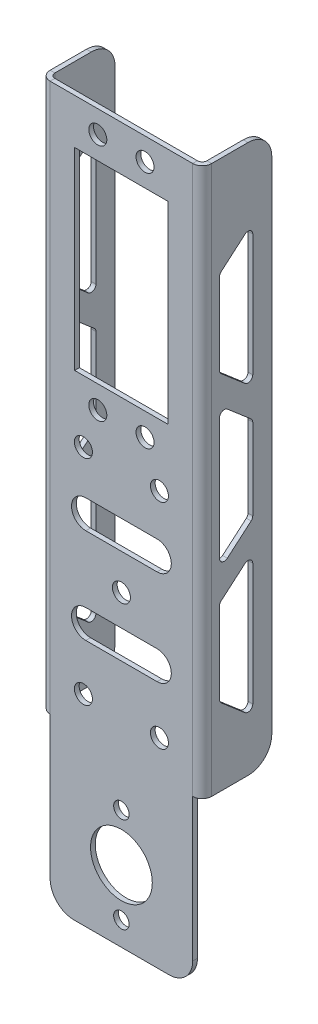
from build123d import *

# Parameters (mm, degrees)
SKETCH1_R                  = 6.5
SKETCH1_W                  = 19.7
SKETCH1_H                  = 40.64
BASE_FLANGE1_DEPTH         = 1
FILLET1_R                  = 5
F_6_CLEARANCE_HOLE1_D      = 3.7973
SKETCHED_START             = 16.78876
SKETCHED_BEND1_OUTLINE_W   = 115.36
SKETCHED_BEND1_OUTLINE_H   = 1
SKETCHED_BEND1_DEPTH       = 13.21124
SKETCHED_START_2           = -30
SKETCHED_BEND1_2_OUTLINE_W = 115.36
SKETCHED_BEND1_2_OUTLINE_H = 1
SKETCHED_BEND1_2_DEPTH     = 13.18876
SKETCHED_START_3           = -17
SKETCHED_BEND1_3_DEPTH     = 2
SKETCHED_START_4           = 15
SKETCHED_BEND1_4_DEPTH     = 2
SKETCHED_START_5           = -40.18
SKETCHED_BEND1_5_DEPTH     = 115.36
F_4_CLEARANCE_HOLE1_D      = 3.2639
FILLET2_R                  = 1
F_6_CLEARANCE_HOLE2_D      = 3.7973
CUT_EXTRUDE1_DEPTH         = 10


with BuildPart() as part:
    # Base-Flange1: sheet metal written as solids
    # Sketch1 → Base-Flange1 (new body)
    with BuildSketch(Plane.XY):
        Polygon((-30, 75.18), (30, 75.18), (30, -40.18), (15, -40.18), (15, -75.18), (-15, -75.18), (-15, -40.18), (-30, -40.18), align=None)
        with Locations((0, -60.18)):
            Circle(SKETCH1_R, mode=Mode.SUBTRACT)
        Polygon((-26, 60.18), (-19, 54.18), (-19, 36.18), (-26, 30.18), align=None, mode=Mode.SUBTRACT)
        with Locations((0, 45.36)):
            Rectangle(SKETCH1_W, SKETCH1_H, mode=Mode.SUBTRACT)
        Polygon((-26, 24.18), (-19, 30.18), (-19, 0.18), (-26, 6.18), align=None, mode=Mode.SUBTRACT)
        Polygon((-26, -29.82), (-26, 0.18), (-19, -5.82), (-19, -23.82), align=None, mode=Mode.SUBTRACT)
        Polygon((19, -23.82), (26, -29.82), (26, 0.18), (19, -5.82), align=None, mode=Mode.SUBTRACT)
        Polygon((19, 0.18), (26, 6.18), (26, 24.18), (19, 30.18), align=None, mode=Mode.SUBTRACT)
        Polygon((19, 36.18), (26, 30.18), (26, 60.18), (19, 54.18), align=None, mode=Mode.SUBTRACT)
    extrude(amount=-BASE_FLANGE1_DEPTH)

    # Fillet1
    fillet1_edges = [part.edges().sort_by_distance(p)[0] for p in [
        (-30, 75.18, -0.5),
        (30, 75.18, -0.5),
        (30, -40.18, -0.5),
        (15, -75.18, -0.5),
        (-15, -75.18, -0.5),
        (-30, -40.18, -0.5),
    ]]
    fillet(fillet1_edges, radius=FILLET1_R)

    # #6 Clearance Hole1 (through all)
    with Locations(Plane.XY):
        with Locations((-4.97, 70.46), (4.97, 70.46), (-4.97, 20.26), (4.97, 20.26)):
            Hole(F_6_CLEARANCE_HOLE1_D / 2)

    # Sketched Bend1: read off the stored shape, not the designer's step
    # Sketched Bend1 outline → Sketched Bend1 (cut)
    with BuildSketch(Plane.YZ.offset(SKETCHED_START)):
        with Locations((17.5, -0.5)):
            Rectangle(SKETCHED_BEND1_OUTLINE_W, SKETCHED_BEND1_OUTLINE_H)
    extrude(amount=SKETCHED_BEND1_DEPTH, mode=Mode.SUBTRACT)

    # Sketched Bend1 2 outline → Sketched Bend1 2 (cut)
    with BuildSketch(Plane.YZ.offset(SKETCHED_START_2)):
        with Locations((17.5, -0.5)):
            Rectangle(SKETCHED_BEND1_2_OUTLINE_W, SKETCHED_BEND1_2_OUTLINE_H)
    extrude(amount=SKETCHED_BEND1_2_DEPTH, mode=Mode.SUBTRACT)

    # Sketched Bend1 3 outline → Sketched Bend1 3 (add)
    with BuildSketch(Plane.YZ.offset(SKETCHED_START_3)):
        with BuildLine():
            Line((75.18, -9.64380551), (75.18, -1))
            Line((75.18, -1), (-40.18, -1))
            Line((-40.18, -1), (-40.18, -9.64380551))
            ThreePointArc((-40.18, -9.64380551), (-38.715533906, -13.179339416), (-35.18, -14.64380551))
            Line((-35.18, -14.64380551), (70.18, -14.64380551))
            ThreePointArc((70.18, -14.64380551), (73.715533906, -13.179339416), (75.18, -9.64380551))
        make_face()
        Polygon((-23.82, -3.64380551), (-5.82, -3.64380551), (0.18, -10.64380551), (-29.82, -10.64380551), align=None, mode=Mode.SUBTRACT)
        Polygon((0.18, -3.64380551), (30.18, -3.64380551), (24.18, -10.64380551), (6.18, -10.64380551), align=None, mode=Mode.SUBTRACT)
        Polygon((54.18, -3.64380551), (60.18, -10.64380551), (30.18, -10.64380551), (36.18, -3.64380551), align=None, mode=Mode.SUBTRACT)
    extrude(amount=SKETCHED_BEND1_3_DEPTH)

    # Sketched Bend1 4 outline → Sketched Bend1 4 (add)
    with BuildSketch(Plane.YZ.offset(SKETCHED_START_4)):
        with BuildLine():
            Line((75.18, -9.64380551), (75.18, -1))
            Line((75.18, -1), (-40.18, -1))
            Line((-40.18, -1), (-40.18, -9.64380551))
            ThreePointArc((-40.18, -9.64380551), (-38.715533906, -13.179339416), (-35.18, -14.64380551))
            Line((-35.18, -14.64380551), (70.18, -14.64380551))
            ThreePointArc((70.18, -14.64380551), (73.715533906, -13.179339416), (75.18, -9.64380551))
        make_face()
        Polygon((-23.82, -3.64380551), (-5.82, -3.64380551), (0.18, -10.64380551), (-29.82, -10.64380551), align=None, mode=Mode.SUBTRACT)
        Polygon((0.18, -3.64380551), (30.18, -3.64380551), (24.18, -10.64380551), (6.18, -10.64380551), align=None, mode=Mode.SUBTRACT)
        Polygon((54.18, -3.64380551), (60.18, -10.64380551), (30.18, -10.64380551), (36.18, -3.64380551), align=None, mode=Mode.SUBTRACT)
    extrude(amount=SKETCHED_BEND1_4_DEPTH)

    # Sketched Bend1 5 outline → Sketched Bend1 5 (cut)
    with BuildSketch(Plane(origin=(0, 0, 0), x_dir=(1, 0, 0), z_dir=(0, 1, 0)).offset(SKETCHED_START_5)):
        with BuildLine():
            ThreePointArc((-16, 2), (-15.707106781, 1.292893219), (-15, 1))
            Line((-15, 1), (-15, 14.64380551))
            Line((-15, 14.64380551), (-16, 14.64380551))
            Line((-16, 14.64380551), (-16, 2))
        make_face()
        with BuildLine():
            ThreePointArc((17, 2), (16.414213562, 0.585786438), (15, 0))
            Line((15, 0), (16.78876, 0))
            Line((16.78876, 0), (16.78876, 1))
            Line((16.78876, 1), (17, 1))
            Line((17, 1), (17, 2))
        make_face()
        with BuildLine():
            ThreePointArc((-15, 0), (-16.414213562, 0.585786438), (-17, 2))
            Line((-17, 2), (-17, 1))
            Line((-17, 1), (-16.81124, 1))
            Line((-16.81124, 1), (-16.81124, 0))
            Line((-16.81124, 0), (-15, 0))
        make_face()
        with BuildLine():
            ThreePointArc((15, 1), (15.707106781, 1.292893219), (16, 2))
            Line((16, 2), (16, 14.64380551))
            Line((16, 14.64380551), (15, 14.64380551))
            Line((15, 14.64380551), (15, 1))
        make_face()
    extrude(amount=SKETCHED_BEND1_5_DEPTH, mode=Mode.SUBTRACT)

    # #4 Clearance Hole1 (through all)
    with Locations(Plane.XY):
        with Locations((0, -50.18), (0, -70.18)):
            Hole(F_4_CLEARANCE_HOLE1_D / 2)

    # Fillet2
    fillet2_edges = [part.edges().sort_by_distance(p)[0] for p in [
        (-16.5, 54.18, -3.64380551),
        (-16.5, 36.18, -3.64380551),
        (-16.5, 30.18, -10.64380551),
        (-16.5, 60.18, -10.64380551),
        (-16.5, 24.18, -10.64380551),
        (-16.5, 30.18, -3.64380551),
        (-16.5, 0.18, -3.64380551),
        (-16.5, 6.18, -10.64380551),
        (-16.5, -23.82, -3.64380551),
        (-16.5, -29.82, -10.64380551),
        (-16.5, 0.18, -10.64380551),
        (-16.5, -5.82, -3.64380551),
        (16.5, 0.18, -10.64380551),
        (16.5, -29.82, -10.64380551),
        (16.5, -23.82, -3.64380551),
        (16.5, -5.82, -3.64380551),
        (16.5, 24.18, -10.64380551),
        (16.5, 6.18, -10.64380551),
        (16.5, 0.18, -3.64380551),
        (16.5, 30.18, -3.64380551),
        (16.5, 60.18, -10.64380551),
        (16.5, 30.18, -10.64380551),
        (16.5, 36.18, -3.64380551),
        (16.5, 54.18, -3.64380551),
    ]]
    fillet(fillet2_edges, radius=FILLET2_R)

    # #6 Clearance Hole2 (through all)
    with Locations(Plane.XY):
        with Locations((-8, 12), (8, 12), (0, -10.5), (-8, -33), (8, -33)):
            Hole(F_6_CLEARANCE_HOLE2_D / 2)

    # Sketch13 → Cut-Extrude1 (cut)
    with BuildSketch(Plane.XY):
        with BuildLine():
            Line((-7.5, 3), (7.5, 3))
            ThreePointArc((7.5, 3), (10.5, 0), (7.5, -3))
            Line((7.5, -3), (-7.5, -3))
            ThreePointArc((-7.5, -3), (-10.5, 0), (-7.5, 3))
        make_face()
        with BuildLine():
            Line((-7.5, -17), (7.5, -17))
            ThreePointArc((7.5, -17), (10.5, -20), (7.5, -23))
            Line((7.5, -23), (-7.5, -23))
            ThreePointArc((-7.5, -23), (-10.5, -20), (-7.5, -17))
        make_face()
    extrude(amount=-CUT_EXTRUDE1_DEPTH, mode=Mode.SUBTRACT)


solid = part.part
